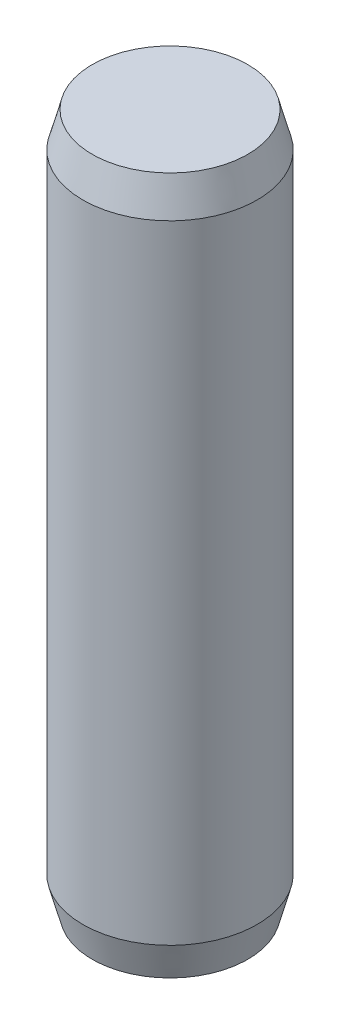
from build123d import *

# Parameters (mm, degrees)
SKE_W          = 3
SKE_H          = 24
CHAMFER2_SIZE  = 1.2
CHAMFER2_SIZE2 = 0.321539031
CHAMFER1_SIZE  = 1.2
CHAMFER1_SIZE2 = 0.321539031


with BuildPart() as part:
    # Ske → Base-Rev (revolve)
    with BuildSketch(Plane.XY):
        with Locations((1.5, 12)):
            Rectangle(SKE_W, SKE_H)
    revolve(axis=Axis((0, 0, 0), (0, 1, 0)))

    # Chamfer2
    chamfer2_edges = [part.edges().sort_by_distance(p)[0] for p in [
        (-3, 0, 0),
    ]]
    chamfer2_side = [part.faces().sort_by_distance(p)[0] for p in [
        (-3, 12, 0),
    ]]
    chamfer(chamfer2_edges, length=CHAMFER2_SIZE, length2=CHAMFER2_SIZE2, reference=chamfer2_side[0])

    # Chamfer1
    chamfer1_edges = [part.edges().sort_by_distance(p)[0] for p in [
        (-3, 24, 0),
    ]]
    chamfer1_side = [part.faces().sort_by_distance(p)[0] for p in [
        (-3, 12.6, 0),
    ]]
    chamfer(chamfer1_edges, length=CHAMFER1_SIZE, length2=CHAMFER1_SIZE2, reference=chamfer1_side[0])


solid = part.part
